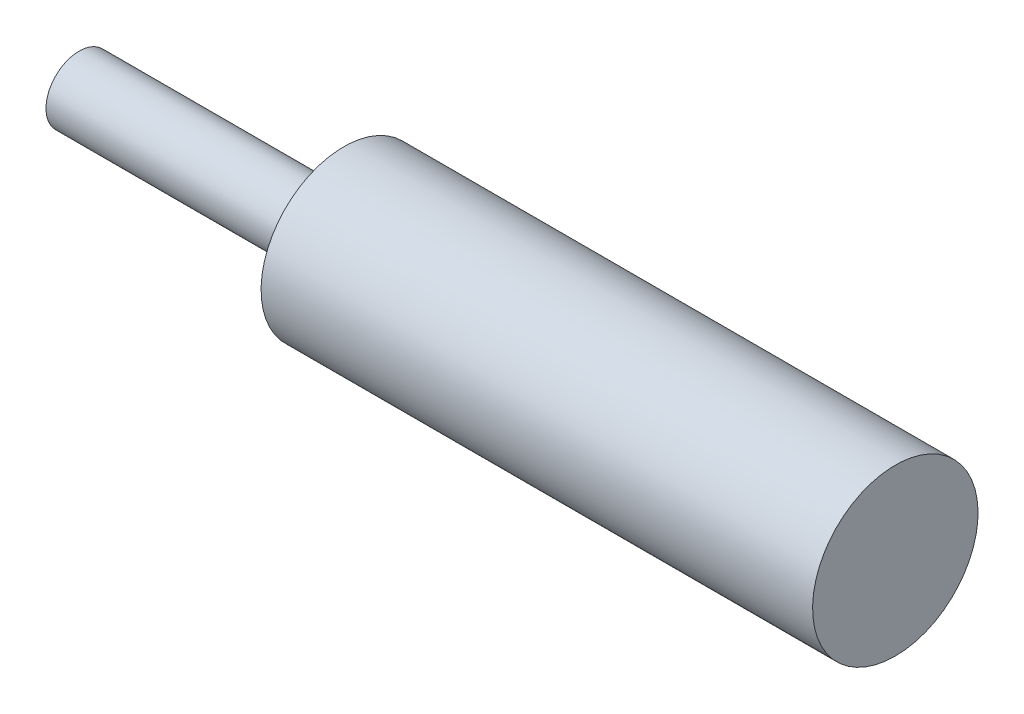
from build123d import *


with BuildPart() as part:
    # Sketch3 → Revolve2 (revolve)
    with BuildSketch(Plane.XY):
        Polygon((-37, 0), (37, 0), (37, 7.5), (-13, 7.5), (-13, 3), (-37, 3), align=None)
    revolve(axis=Axis((-37, 0, 0), (1, 0, 0)))


solid = part.part
